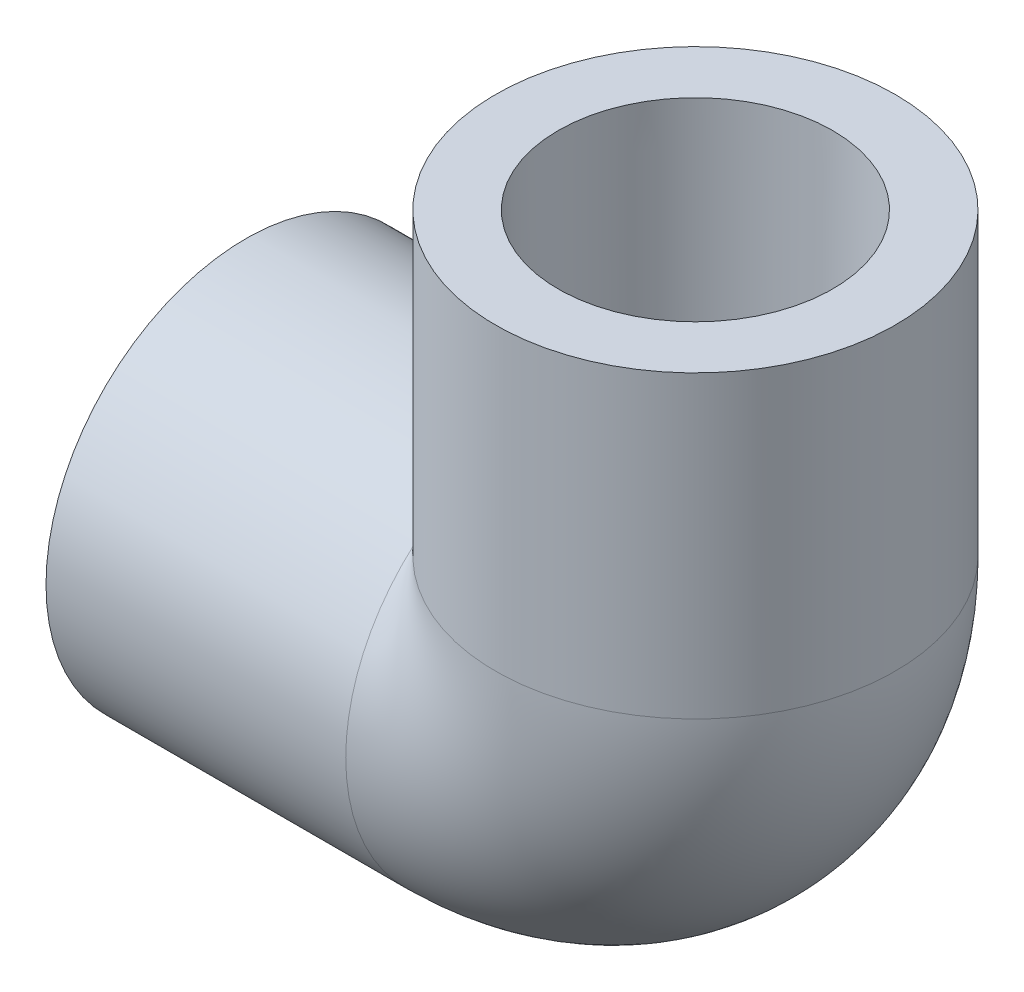
from build123d import *

# Parameters (mm, degrees)
SKETCH3_R   = 12.7
SKETCH3_R_2 = 6.2611


with BuildPart() as part:
    # Sketch1 → Revolve1 (revolve)
    with BuildSketch(Plane.XY):
        Polygon((-28.575, -12.7), (-9.525, -12.7), (-9.525, -8.5217), (-28.575, -8.7249), align=None)
    revolve(axis=Axis((-28.575, 0, 0), (1, 0, 0)))


with BuildPart() as body_2:
    # Sketch2 → Revolve2 (revolve)
    with BuildSketch(Plane.XY):
        Polygon((8.7249, 28.575), (8.5217, 9.525), (12.7, 9.525), (12.7, 28.575), align=None)
    revolve(axis=Axis((0, 0, 0), (0, 1, 0)))


with BuildPart() as sweep1_tool:
    # Sweep1: sweep along a path in Sketch4
    with BuildLine(Plane.XY) as sweep1_path:
        ThreePointArc((-9.525, 0), (-2.789808, 2.789808), (0, 9.525))
    # Sketch3 → Sweep1 (sweep)
    with BuildSketch(Plane(origin=(-9.525, 0, 0), x_dir=(0, 0, -1), z_dir=(1, 0, 0))):
        Circle(SKETCH3_R)
        Circle(SKETCH3_R_2, mode=Mode.SUBTRACT)
    sweep(path=sweep1_path.line)


with BuildPart() as part_1:
    add(part.part)


with BuildPart() as part_2:
    # Sweep1: joined with sweep1_tool
    add(part_1.part.fuse(sweep1_tool.part, body_2.part, tol=0.00001))


solid = part_2.part
